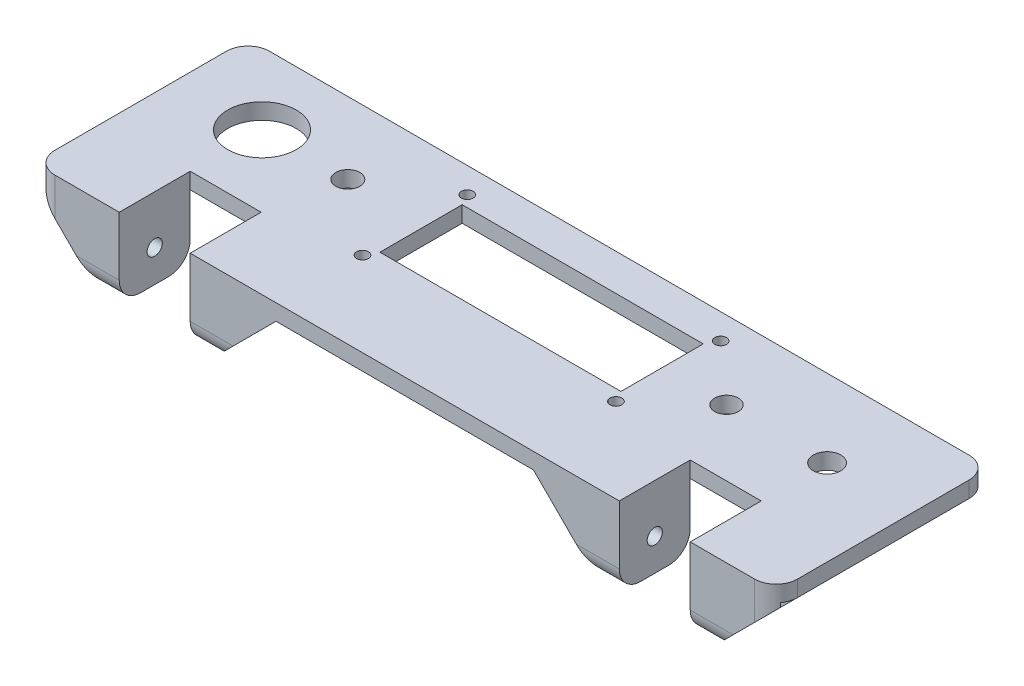
from build123d import *

# Parameters (mm, degrees)
BOSS_EXTRUDE1_DEPTH = 4.7625
CUT_EXTRUDE1_REACH  = 129.016
SKETCH3_R           = 10.16
SKETCH3_R_2         = 3.556
SKETCH3_R_3         = 1.75
SKETCH3_R_4         = 3.4925
SKETCH3_R_5         = 4.064
SKETCH3_W           = 71.35
SKETCH3_H           = 24.35
SKETCH4_W           = 6.35
SKETCH4_H           = 21
BOSS_EXTRUDE2_DEPTH = 19.05
SKETCH5_R           = 2.25
CUT_EXTRUDE2_DEPTH  = 212.413611199
BOSS_EXTRUDE3_DEPTH = 2.54
BOSS_EXTRUDE4_DEPTH = 2.54
FILLET1_R           = 6.35


with BuildPart() as part:
    # Sketch2 → Boss-Extrude1 (new body)
    with BuildSketch(Plane(origin=(0, 0, 0), x_dir=(1, 0, 0), z_dir=(0, 1, 0))):
        Polygon((-109.9, 0), (109.9, 0), (109.9, -63.5), (84.5, -63.5), (84.5, -42.5), (63.5, -42.5), (63.5, -63.5), (-63.5, -63.5), (-63.5, -42.5), (-84.5, -42.5), (-84.5, -63.5), (-109.9, -63.5), align=None)
    extrude(amount=BOSS_EXTRUDE1_DEPTH)

    # Sketch3 → Cut-Extrude1 (cut, up to next)
    with BuildSketch(Plane(origin=(0, 4.7625, 0), x_dir=(1, 0, 0), z_dir=(0, 1, 0)), mode=Mode.PRIVATE) as cut_extrude1_sk1:
        with Locations(Location((-84.5, -21.25, 0), (0, 0, 270))):
            Circle(SKETCH3_R)
    cut_extrude1_tool1 = extrude(cut_extrude1_sk1.sketch, amount=-CUT_EXTRUDE1_REACH, mode=Mode.PRIVATE) & part.part
    # Sketch3 → Cut-Extrude1 (cut, up to next)
    with BuildSketch(Plane(origin=(0, 4.7625, 0), x_dir=(1, 0, 0), z_dir=(0, 1, 0)), mode=Mode.PRIVATE) as cut_extrude1_sk2:
        with Locations(Location((-59.1, -21.25, 0), (0, 0, 270))):
            Circle(SKETCH3_R_2)
    cut_extrude1_tool2 = extrude(cut_extrude1_sk2.sketch, amount=-CUT_EXTRUDE1_REACH, mode=Mode.PRIVATE) & part.part
    # Sketch3 → Cut-Extrude1 (cut, up to next)
    with BuildSketch(Plane(origin=(0, 4.7625, 0), x_dir=(1, 0, 0), z_dir=(0, 1, 0)), mode=Mode.PRIVATE) as cut_extrude1_sk3:
        with Locations(Location((-37.5, -38.5, 0), (0, 0, 270))):
            Circle(SKETCH3_R_3)
    cut_extrude1_tool3 = extrude(cut_extrude1_sk3.sketch, amount=-CUT_EXTRUDE1_REACH, mode=Mode.PRIVATE) & part.part
    # Sketch3 → Cut-Extrude1 (cut, up to next)
    with BuildSketch(Plane(origin=(0, 4.7625, 0), x_dir=(1, 0, 0), z_dir=(0, 1, 0)), mode=Mode.PRIVATE) as cut_extrude1_sk4:
        with Locations(Location((-37.5, -7.5, 0), (0, 0, 270))):
            Circle(SKETCH3_R_3)
    cut_extrude1_tool4 = extrude(cut_extrude1_sk4.sketch, amount=-CUT_EXTRUDE1_REACH, mode=Mode.PRIVATE) & part.part
    # Sketch3 → Cut-Extrude1 (cut, up to next)
    with BuildSketch(Plane(origin=(0, 4.7625, 0), x_dir=(1, 0, 0), z_dir=(0, 1, 0)), mode=Mode.PRIVATE) as cut_extrude1_sk5:
        with Locations(Location((37.5, -38.5, 0), (0, 0, 90))):
            Circle(SKETCH3_R_3)
    cut_extrude1_tool5 = extrude(cut_extrude1_sk5.sketch, amount=-CUT_EXTRUDE1_REACH, mode=Mode.PRIVATE) & part.part
    # Sketch3 → Cut-Extrude1 (cut, up to next)
    with BuildSketch(Plane(origin=(0, 4.7625, 0), x_dir=(1, 0, 0), z_dir=(0, 1, 0)), mode=Mode.PRIVATE) as cut_extrude1_sk6:
        with Locations(Location((37.5, -7.5, 0), (0, 0, 90))):
            Circle(SKETCH3_R_3)
    cut_extrude1_tool6 = extrude(cut_extrude1_sk6.sketch, amount=-CUT_EXTRUDE1_REACH, mode=Mode.PRIVATE) & part.part
    # Sketch3 → Cut-Extrude1 (cut, up to next)
    with BuildSketch(Plane(origin=(0, 4.7625, 0), x_dir=(1, 0, 0), z_dir=(0, 1, 0)), mode=Mode.PRIVATE) as cut_extrude1_sk7:
        with Locations(Location((54.725, -23, 0), (0, 0, 270))):
            Circle(SKETCH3_R_4)
    cut_extrude1_tool7 = extrude(cut_extrude1_sk7.sketch, amount=-CUT_EXTRUDE1_REACH, mode=Mode.PRIVATE) & part.part
    # Sketch3 → Cut-Extrude1 (cut, up to next)
    with BuildSketch(Plane(origin=(0, 4.7625, 0), x_dir=(1, 0, 0), z_dir=(0, 1, 0)), mode=Mode.PRIVATE) as cut_extrude1_sk8:
        with Locations(Location((84.5, -23, 0), (0, 0, 270))):
            Circle(SKETCH3_R_5)
    cut_extrude1_tool8 = extrude(cut_extrude1_sk8.sketch, amount=-CUT_EXTRUDE1_REACH, mode=Mode.PRIVATE) & part.part
    # Sketch3 → Cut-Extrude1 (cut, up to next)
    with BuildSketch(Plane(origin=(0, 4.7625, 0), x_dir=(1, 0, 0), z_dir=(0, 1, 0)), mode=Mode.PRIVATE) as cut_extrude1_sk9:
        with Locations((0, -23)):
            Rectangle(SKETCH3_W, SKETCH3_H)
    cut_extrude1_tool9 = extrude(cut_extrude1_sk9.sketch, amount=-CUT_EXTRUDE1_REACH, mode=Mode.PRIVATE) & part.part
    add(cut_extrude1_tool1.solids().sort_by_distance((-84.5, 4.7625, 21.25))[0], mode=Mode.SUBTRACT)
    add(cut_extrude1_tool2.solids().sort_by_distance((-59.1, 4.7625, 21.25))[0], mode=Mode.SUBTRACT)
    add(cut_extrude1_tool3.solids().sort_by_distance((-37.5, 4.7625, 38.5))[0], mode=Mode.SUBTRACT)
    add(cut_extrude1_tool4.solids().sort_by_distance((-37.5, 4.7625, 7.5))[0], mode=Mode.SUBTRACT)
    add(cut_extrude1_tool5.solids().sort_by_distance((37.5, 4.7625, 38.5))[0], mode=Mode.SUBTRACT)
    add(cut_extrude1_tool6.solids().sort_by_distance((37.5, 4.7625, 7.5))[0], mode=Mode.SUBTRACT)
    add(cut_extrude1_tool7.solids().sort_by_distance((54.725, 4.7625, 23))[0], mode=Mode.SUBTRACT)
    add(cut_extrude1_tool8.solids().sort_by_distance((84.5, 4.7625, 23))[0], mode=Mode.SUBTRACT)
    add(cut_extrude1_tool9.solids().sort_by_distance((0, 4.7625, 23))[0], mode=Mode.SUBTRACT)

    # Sketch4 → Boss-Extrude2 (add)
    with BuildSketch(Plane.XZ):
        with Locations((-87.675, 53)):
            Rectangle(SKETCH4_W, SKETCH4_H)
        with Locations((87.675, 53)):
            Rectangle(SKETCH4_W, SKETCH4_H)
        with Locations((-60.325, 53)):
            Rectangle(SKETCH4_W, SKETCH4_H)
        with Locations((60.325, 53)):
            Rectangle(SKETCH4_W, SKETCH4_H)
    extrude(amount=BOSS_EXTRUDE2_DEPTH)

    # Sketch5 → Cut-Extrude2 (cut, through all)
    with BuildSketch(Plane(origin=(90.85, 0, 0), x_dir=(0, 0, -1), z_dir=(1, 0, 0))):
        with Locations((-53, -9.525)):
            Circle(SKETCH5_R)
    extrude(amount=-CUT_EXTRUDE2_DEPTH, mode=Mode.SUBTRACT)

    # Sketch6 → Boss-Extrude3 (add)
    with BuildSketch(Plane.XY.offset(63.5)):
        Polygon((90.85, -19.05), (109.9, 0), (90.85, 0), align=None)
        Polygon((57.15, -19.05), (38.1, 0), (57.15, 0), align=None)
        Polygon((-90.85, -19.05), (-90.85, 0), (-109.9, 0), align=None)
        Polygon((-57.15, -19.05), (-57.15, 0), (-38.1, 0), align=None)
    extrude(amount=-BOSS_EXTRUDE3_DEPTH)

    # Sketch7 → Boss-Extrude4 (add)
    with BuildSketch(Plane(origin=(0, 0, 42.5), x_dir=(-1, 0, 0), z_dir=(0, 0, -1))):
        Polygon((-90.85, -19.05), (-90.85, 0), (-109.9, 0), align=None)
        Polygon((-57.15, 0), (-38.1, 0), (-57.15, -19.05), align=None)
        Polygon((57.15, 0), (57.15, -19.05), (38.1, 0), align=None)
        Polygon((90.85, 0), (90.85, -19.05), (109.9, 0), align=None)
    extrude(amount=-BOSS_EXTRUDE4_DEPTH)

    # Fillet1
    # the kernel refuses this fillet: 6.35 mm, written as the material it takes off along each edge
    with BuildSketch(Plane(origin=(-79.375, -19.05, 42.5), x_dir=(0, 1, 0), z_dir=(1, 0, 0)), Plane(origin=(-41.275, -19.05, 63.5), x_dir=(0, 1, 0), z_dir=(-1, 0, 0)), Plane(origin=(79.375, -19.05, 42.5), x_dir=(0, 0, 1), z_dir=(-1, 0, 0)), Plane(origin=(68.625, -19.05, 42.5), x_dir=(0, 1, 0), z_dir=(1, 0, 0))) as fillet1_piece_1:
        with BuildLine():
            CenterArc((FILLET1_R, FILLET1_R), FILLET1_R, 180, 90)
            Line((0, FILLET1_R), (0, 0))
            Line((0, 0), (FILLET1_R, 0))
        make_face()
    extrude(amount=38.1, mode=Mode.SUBTRACT)
    with BuildSketch(Plane(origin=(41.275, -19.05, 63.5), x_dir=(0, 1, 0), z_dir=(1, 0, 0)), Plane(origin=(-68.625, -19.05, 63.5), x_dir=(0, 0, -1), z_dir=(-1, 0, 0)), Plane(origin=(-106.725, -19.05, 42.5), x_dir=(0, 0, 1), z_dir=(1, 0, 0)), Plane(origin=(106.725, -19.05, 63.5), x_dir=(0, 0, -1), z_dir=(-1, 0, 0))) as fillet1_piece_2:
        with BuildLine():
            CenterArc((FILLET1_R, -FILLET1_R), FILLET1_R, 90, 90)
            Line((0, -FILLET1_R), (0, 0))
            Line((0, 0), (FILLET1_R, 0))
        make_face()
    extrude(amount=38.1, mode=Mode.SUBTRACT)
    with BuildSketch(Plane(origin=(109.9, -15.875, 63.5), x_dir=(-1, 0, 0), z_dir=(0, 1, 0)), Plane(origin=(-109.9, -15.875, 0), x_dir=(1, 0, 0), z_dir=(0, 1, 0))) as fillet1_piece_3:
        with BuildLine():
            CenterArc((FILLET1_R, -FILLET1_R), FILLET1_R, 90, 90)
            Line((0, -FILLET1_R), (0, 0))
            Line((0, 0), (FILLET1_R, 0))
        make_face()
    extrude(amount=36.5125, mode=Mode.SUBTRACT)
    with BuildSketch(Plane(origin=(-109.9, -15.875, 63.5), x_dir=(1, 0, 0), z_dir=(0, 1, 0)), Plane(origin=(109.9, -15.875, 0), x_dir=(-1, 0, 0), z_dir=(0, 1, 0))) as fillet1_piece_4:
        with BuildLine():
            CenterArc((FILLET1_R, FILLET1_R), FILLET1_R, 180, 90)
            Line((0, FILLET1_R), (0, 0))
            Line((0, 0), (FILLET1_R, 0))
        make_face()
    extrude(amount=36.5125, mode=Mode.SUBTRACT)


solid = part.part
